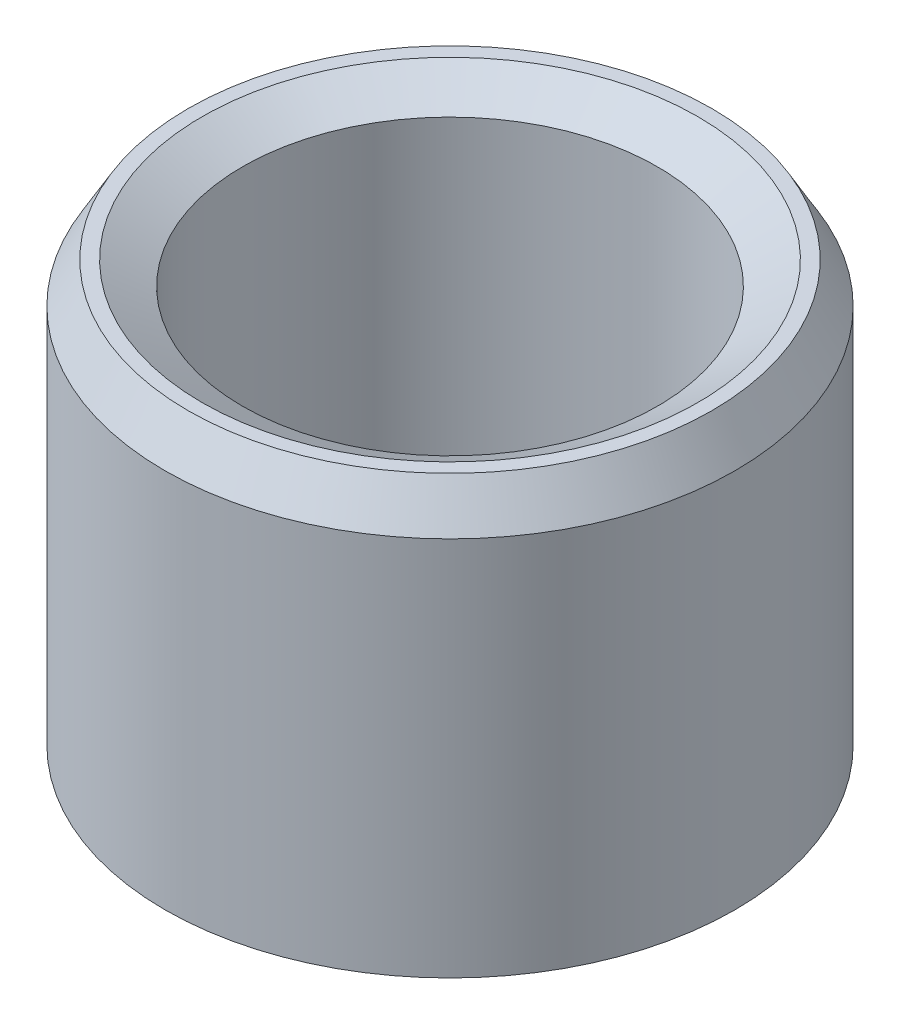
from build123d import *
from OCP.BRepFilletAPI import BRepFilletAPI_MakeChamfer

# Parameters (mm, degrees)
SKETCH1_R           = 12.5
BOSS_EXTRUDE1_DEPTH = 19.462121067
SKETCH2_R           = 9.097639314
CUT_EXTRUDE1_DEPTH  = 27.29209304
CHAMFER1_SIZE       = 1.767523007
CHAMFER1_SIZE2      = 1.020479884


with BuildPart() as part:
    # Sketch1 → Boss-Extrude1 (new body)
    with BuildSketch(Plane(origin=(0, 0, 0), x_dir=(1, 0, 0), z_dir=(0, 1, 0))):
        Circle(SKETCH1_R)
    extrude(amount=BOSS_EXTRUDE1_DEPTH)

    # Sketch2 → Cut-Extrude1 (cut, through all)
    with BuildSketch(Plane(origin=(0, 0, 0), x_dir=(1, 0, 0), z_dir=(0, 1, 0))):
        Circle(SKETCH2_R)
    extrude(amount=CUT_EXTRUDE1_DEPTH, mode=Mode.SUBTRACT)

    # Chamfer1: one chamfer whose edges measure the first distance from different faces: ONE call of the kernel's chamfer builder (chamfer() names one face for all edges)
    chamfer1_edges_1 = [part.edges().sort_by_distance(p)[0] for p in [
        (-9.097639314, 19.462121067, 0),
    ]]
    chamfer1_side_1 = [part.faces().sort_by_distance(p)[0] for p in [
        (-12.146446609, 19.462121067, 0),
    ]]
    chamfer1_edges_2 = [part.edges().sort_by_distance(p)[0] for p in [
        (-9.097639314, 0, 0),
    ]]
    chamfer1_side_2 = [part.faces().sort_by_distance(p)[0] for p in [
        (-9.097639314, 9.731060534, 0),
    ]]
    chamfer1_edges_3 = [part.edges().sort_by_distance(p)[0] for p in [
        (-12.5, 0, 0),
    ]]
    chamfer1_side_3 = [part.faces().sort_by_distance(p)[0] for p in [
        (-12.146446609, 0, 0),
    ]]
    chamfer1_edges_4 = [part.edges().sort_by_distance(p)[0] for p in [
        (-12.5, 19.462121067, 0),
    ]]
    chamfer1_side_4 = [part.faces().sort_by_distance(p)[0] for p in [
        (-12.5, 9.731060534, 0),
    ]]
    chamfer1 = BRepFilletAPI_MakeChamfer(part.part.solid().wrapped)
    for e in chamfer1_edges_1:
        chamfer1.Add(CHAMFER1_SIZE, CHAMFER1_SIZE2, e.wrapped, chamfer1_side_1[0].wrapped)  # the first distance lies on this face
    for e in chamfer1_edges_2:
        chamfer1.Add(CHAMFER1_SIZE, CHAMFER1_SIZE2, e.wrapped, chamfer1_side_2[0].wrapped)  # the first distance lies on this face
    for e in chamfer1_edges_3:
        chamfer1.Add(CHAMFER1_SIZE, CHAMFER1_SIZE2, e.wrapped, chamfer1_side_3[0].wrapped)  # the first distance lies on this face
    for e in chamfer1_edges_4:
        chamfer1.Add(CHAMFER1_SIZE, CHAMFER1_SIZE2, e.wrapped, chamfer1_side_4[0].wrapped)  # the first distance lies on this face
    add(Compound.cast(chamfer1.Shape()), mode=Mode.REPLACE)


solid = part.part
